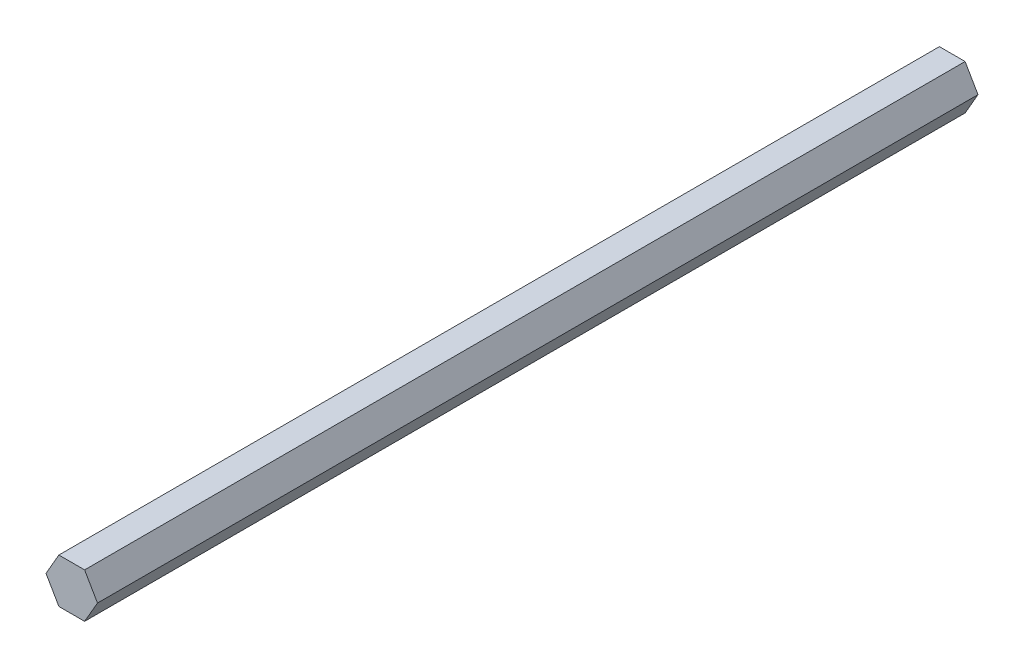
from build123d import *

# Parameters (mm, degrees)
BOSS_EXTRUDE1_DEPTH = 250.825


with BuildPart() as part:
    # Sketch1 → Boss-Extrude1 (new body)
    with BuildSketch(Plane.XY):
        Polygon((-7.332348419, 0), (-3.666174209, -6.35), (3.666174209, -6.35), (7.332348419, 0), (3.666174209, 6.35), (-3.666174209, 6.35), align=None)
    extrude(amount=BOSS_EXTRUDE1_DEPTH)


solid = part.part
